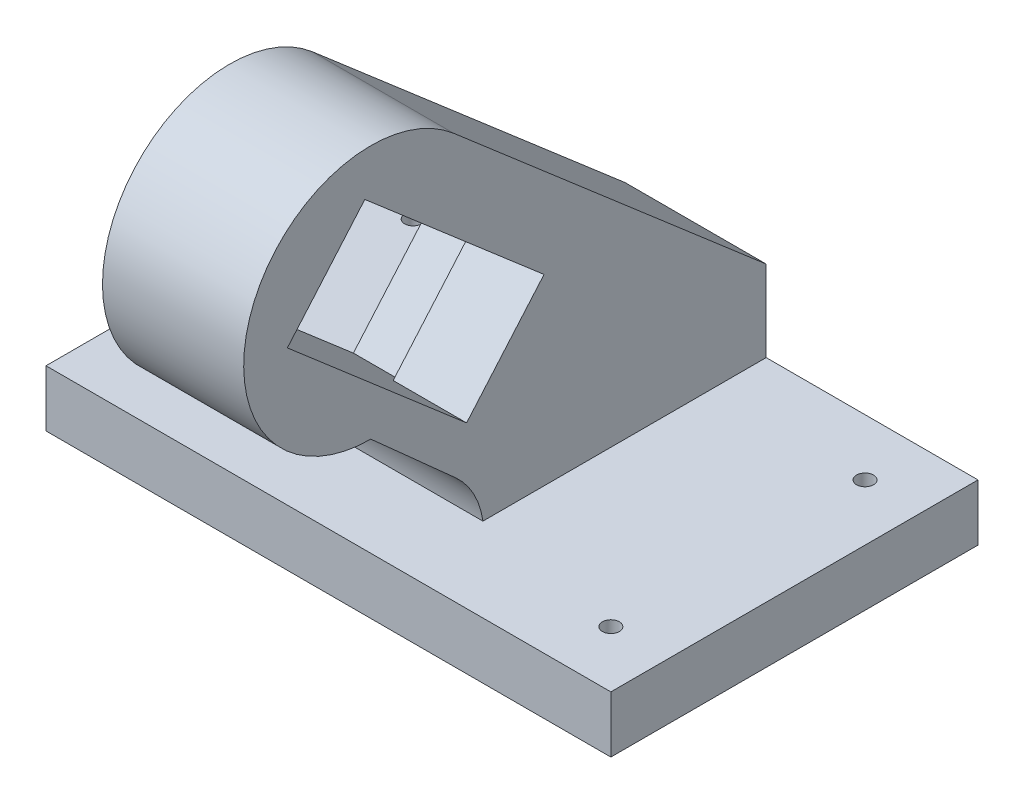
from build123d import *

# Parameters (mm, degrees)
SKETCH2_W               = 100
SKETCH2_H               = 100
BOSS_EXTRUDE1_DEPTH     = 10
SKETCH3_W               = 25
SKETCH3_H               = 100
BOSS_EXTRUDE2_DEPTH     = 100
CUT_EXTRUDE3_DEPTH      = 137.037678604
CUT_EXTRUDE3_DEPTH_BACK = 137.037678604
CUT_EXTRUDE4_DEPTH      = 112.411399776
CUT_EXTRUDE4_DEPTH_BACK = 112.411399776
CUT_EXTRUDE5_DEPTH      = 12
CUT_EXTRUDE7_DEPTH      = 105.910676292
CUT_EXTRUDE7_DEPTH_BACK = 10
SKETCH16_W              = 100
SKETCH16_H              = 35
SKETCH17_R              = 1.5
CUT_EXTRUDE8_DEPTH      = 105.910676292


with BuildPart() as part:
    # Sketch2 → Boss-Extrude1 (new body)
    with BuildSketch(Plane(origin=(0, 0, 0), x_dir=(1, 0, 0), z_dir=(0, 1, 0))):
        Rectangle(SKETCH2_W, SKETCH2_H)
    extrude(amount=BOSS_EXTRUDE1_DEPTH)

    # Sketch3 → Boss-Extrude2 (add)
    with BuildSketch(Plane(origin=(0, 10, 0), x_dir=(1, 0, 0), z_dir=(0, 1, 0))):
        Rectangle(SKETCH3_W, SKETCH3_H)
    extrude(amount=BOSS_EXTRUDE2_DEPTH)

    # Sketch4 → Cut-Extrude3 (cut, two sides: drawn at the far end of the back side and taken through both)
    with BuildSketch(Plane.ZY.offset(12.5).offset(-CUT_EXTRUDE3_DEPTH_BACK)):
        with BuildLine():
            ThreePointArc((5, 19.083592135), (1.769637802, 14.971315355), (0.147267966, 10))
            Line((0.147267966, 10), (50, 10))
            Line((50, 10), (50, 110))
            Line((50, 110), (-50, 110))
            Line((-50, 110), (-50, 24.347807147))
            Line((-50, 24.347807147), (5.30640787, 72.039611214))
            ThreePointArc((5.30640787, 72.039611214), (29.371344009, 75.45551054), (42.5, 55))
            ThreePointArc((42.5, 55), (35.909902577, 39.090097423), (20, 32.5))
            Line((20, 32.5), (5, 19.083592135))
        make_face()
    extrude(amount=CUT_EXTRUDE3_DEPTH + CUT_EXTRUDE3_DEPTH_BACK, mode=Mode.SUBTRACT)

    # Sketch13 → Cut-Extrude4 (cut, two sides: drawn at the far end of the back side and taken through both)
    with BuildSketch(Plane.ZY.offset(12.5).offset(-CUT_EXTRUDE4_DEPTH_BACK)):
        Polygon((21.056943103, 69.7761758), (-10.674599558, 42.413442012), (3.039419763, 26.509804879), (34.770962424, 53.872538667), align=None)
    extrude(amount=CUT_EXTRUDE4_DEPTH + CUT_EXTRUDE4_DEPTH_BACK, mode=Mode.SUBTRACT)

    # Sketch14 → Cut-Extrude5 (cut)
    with BuildSketch(Plane.ZY.offset(12.5)):
        Polygon((-15.635019711, 38.135974081), (-1.92100039, 22.232336948), (39.731382578, 58.150006598), (26.017363257, 74.053643731), align=None)
    extrude(amount=-CUT_EXTRUDE5_DEPTH, mode=Mode.SUBTRACT)

    # Sketch16 → Cut-Extrude7 (cut, two sides: drawn at the far end of the back side and taken through both)
    with BuildSketch(Plane.XZ.offset(-CUT_EXTRUDE7_DEPTH_BACK)):
        with Locations((0, 32.5)):
            Rectangle(SKETCH16_W, SKETCH16_H)
    extrude(amount=CUT_EXTRUDE7_DEPTH + CUT_EXTRUDE7_DEPTH_BACK, mode=Mode.SUBTRACT)

    # Sketch17 → Cut-Extrude8 (cut, through all)
    with BuildSketch(Plane.XZ):
        with Locations((-40, 5)):
            Circle(SKETCH17_R)
        with Locations((40, 5)):
            Circle(SKETCH17_R)
        with Locations((40, -40)):
            Circle(SKETCH17_R)
        with Locations((-40, -40)):
            Circle(SKETCH17_R)
    extrude(amount=-CUT_EXTRUDE8_DEPTH, mode=Mode.SUBTRACT)


solid = part.part
